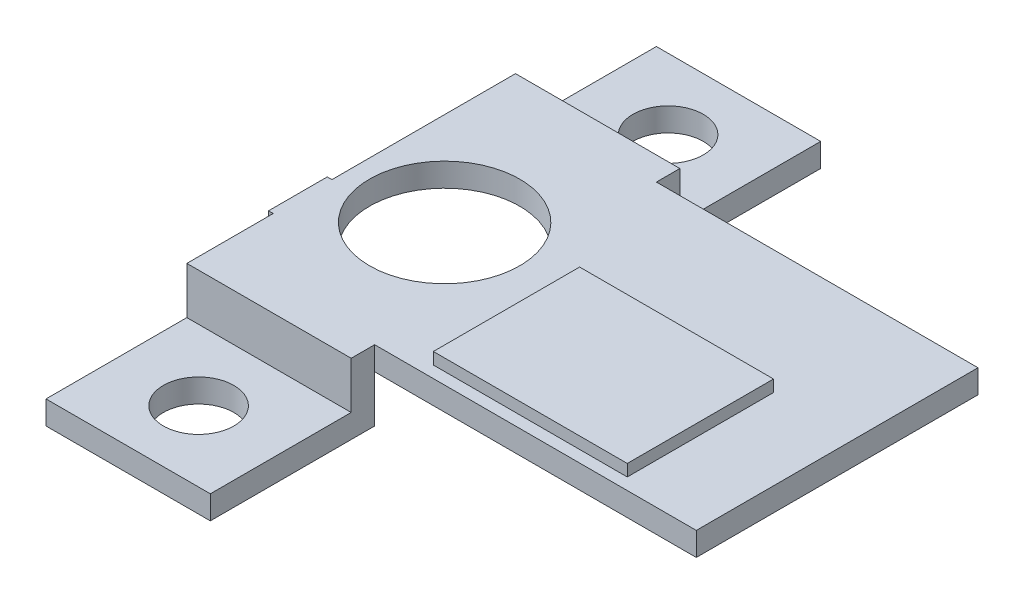
from build123d import *

# Parameters (mm, degrees)
SKETCH_2_W          = 20.7
SKETCH_2_H          = 12
SKETCH_2_R          = 3.2
SKETCH_2_W_2        = 7.26
SKETCH_2_H_2        = 5.23
EXTRUDE_1_DEPTH     = 1
SKETCH_3_W          = 8.26
SKETCH_3_H          = 6.23
EXTRUDE_2_DEPTH     = 0.5
SKETCH_4_W          = 2.5
SKETCH_4_H          = 1
EXTRUDE_3_DEPTH     = 0.2
SKETCH_5_W          = 7
SKETCH_5_H          = 3
EXTRUDE_4_DEPTH     = 1
SKETCH_6_W          = 7
SKETCH_6_H          = 3
EXTRUDE_5_DEPTH     = 1
SKETCH_7_W          = 7
SKETCH_7_H          = 1
EXTRUDE_6_DEPTH     = 6
SKETCH_8_W          = 7
SKETCH_8_H          = 1
EXTRUDE_7_DEPTH     = 6
SKETCH_9_R          = 1.5
CUT_EXTRUDE_1_DEPTH = 1


with BuildPart() as part:
    # 草图2 → 凸台-拉伸1 (new body)
    with BuildSketch(Plane(origin=(0, 0, 0), x_dir=(1, 0, 0), z_dir=(0, 1, 0))):
        with Locations((1.372464899, -0.978393136)):
            Rectangle(SKETCH_2_W, SKETCH_2_H)
        with Locations((-4.997535101, -0.978393136)):
            Circle(SKETCH_2_R, mode=Mode.SUBTRACT)
        with Locations((4.152464899, -3.363393136)):
            Rectangle(SKETCH_2_W_2, SKETCH_2_H_2, mode=Mode.SUBTRACT)
    extrude(amount=EXTRUDE_1_DEPTH)

    # 草图3 → 凸台-拉伸2 (add)
    with BuildSketch(Plane(origin=(0, 1, 0), x_dir=(1, 0, 0), z_dir=(0, 1, 0))):
        with Locations((4.152464899, -3.363393136)):
            Rectangle(SKETCH_3_W, SKETCH_3_H)
    extrude(amount=EXTRUDE_2_DEPTH)

    # 草图4 → 凸台-拉伸3 (add)
    with BuildSketch(Plane.ZY.offset(8.977535101)):
        with Locations((3.048393136, 0.5)):
            Rectangle(SKETCH_4_W, SKETCH_4_H)
    extrude(amount=EXTRUDE_3_DEPTH)

    # 草图5 → 凸台-拉伸4 (add)
    with BuildSketch(Plane.XY.offset(6.978393136)):
        with Locations((-5.477535101, -0.5)):
            Rectangle(SKETCH_5_W, SKETCH_5_H)
    extrude(amount=EXTRUDE_4_DEPTH)

    # 草图6 → 凸台-拉伸5 (add)
    with BuildSketch(Plane(origin=(0, 0, -5.021606864), x_dir=(-1, 0, 0), z_dir=(0, 0, -1))):
        with Locations((5.477535101, -0.5)):
            Rectangle(SKETCH_6_W, SKETCH_6_H)
    extrude(amount=EXTRUDE_5_DEPTH)

    # 草图7 → 凸台-拉伸6 (add)
    with BuildSketch(Plane.XY.offset(7.978393136)):
        with Locations((-5.477535101, -1.5)):
            Rectangle(SKETCH_7_W, SKETCH_7_H)
    extrude(amount=EXTRUDE_6_DEPTH)

    # 草图8 → 凸台-拉伸7 (add)
    with BuildSketch(Plane(origin=(0, 0, -6.021606864), x_dir=(-1, 0, 0), z_dir=(0, 0, -1))):
        with Locations((5.477535101, -1.5)):
            Rectangle(SKETCH_8_W, SKETCH_8_H)
    extrude(amount=EXTRUDE_7_DEPTH)

    # 草图9 → 切除-拉伸1 (cut)
    with BuildSketch(Plane(origin=(0, -1, 0), x_dir=(1, 0, 0), z_dir=(0, 1, 0))):
        with Locations((-5.477535101, 9.021606864)):
            Circle(SKETCH_9_R)
        with Locations((-5.477535101, -10.978393136)):
            Circle(SKETCH_9_R)
    extrude(amount=-CUT_EXTRUDE_1_DEPTH, mode=Mode.SUBTRACT)


solid = part.part
